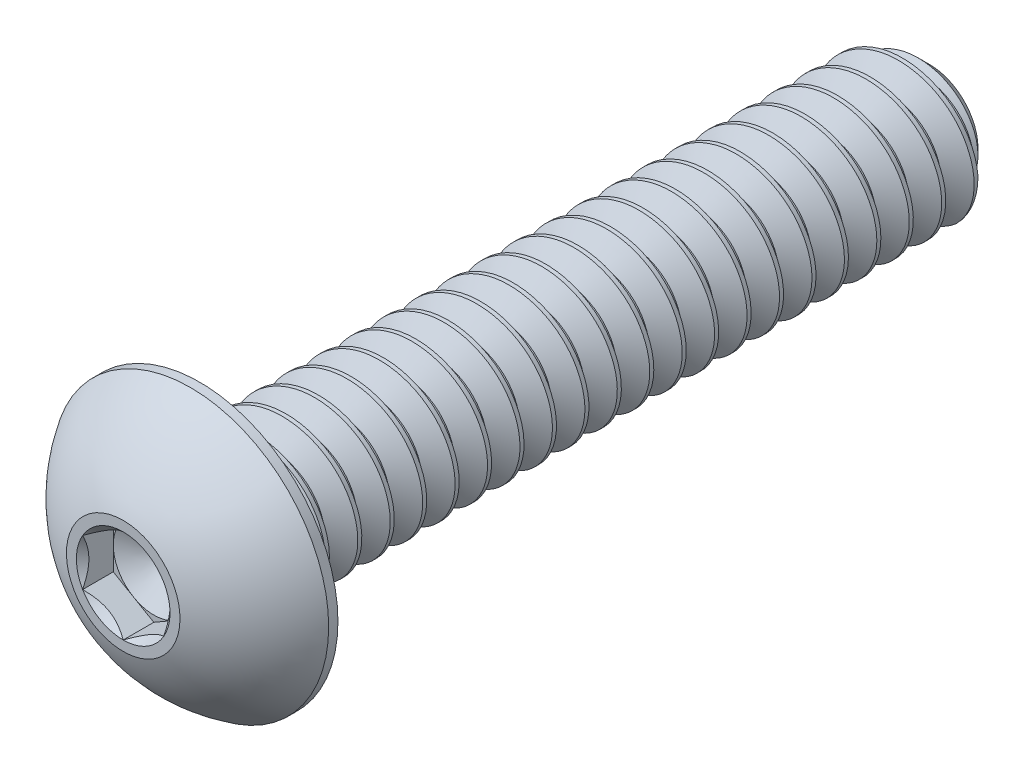
from build123d import *

# Parameters (mm, degrees)
CUT_EXTRUDE1_START = 7.29361
CUT_EXTRUDE1_DEPTH = 2.477670997
CUT_SWEEP1_PITCH   = 0.635
CUT_SWEEP1_TO      = 14.2875


with BuildPart() as part:
    # Sketch2 → Revolve1 (revolve)
    with BuildSketch(Plane(origin=(0, 0, 0), x_dir=(0, 0, -1), z_dir=(1, 0, 0)), mode=Mode.PRIVATE) as revolve1_sk:
        with BuildLine():
            Line((-7.89305, 0.79375), (-7.89305, 1.11125))
            ThreePointArc((-7.89305, 1.11125), (-7.36812089, 2.018629974), (-6.575878571, 2.7051))
            Line((-6.575878571, 2.7051), (-6.39445, 2.7051))
            Line((-6.39445, 2.7051), (-6.39445, 1.4224))
            Line((-6.39445, 1.4224), (7.4168, 1.4224))
            Line((7.4168, 1.4224), (7.89305, 0.94615))
            Line((7.89305, 0.94615), (7.89305, 0))
            Line((7.89305, 0), (-6.835338224, 0))
            Line((-6.835338224, 0), (-7.29361, 0.79375))
            Line((-7.29361, 0.79375), (-7.89305, 0.79375))
        make_face()
    revolve(revolve1_sk.sketch.rotate(Axis((0, 0, 7.89305), (0, 0, -1)), 90), axis=Axis((0, 0, 7.89305), (0, 0, -1)))

    # Sketch3 → Cut-Extrude1 (cut, through all)
    with BuildSketch(Plane.XY.offset(CUT_EXTRUDE1_START)):
        Polygon((0, 0.916543552), (-0.79375, 0.458271776), (-0.79375, -0.458271776), (0, -0.916543552), (0.79375, -0.458271776), (0.79375, 0.458271776), align=None)
    extrude(amount=CUT_EXTRUDE1_DEPTH, mode=Mode.SUBTRACT)

    # Cut-Extrude2 cone 1 section (through the dimple's axis) → Cut-Extrude2 (revolve, cut)
    with BuildSketch(Plane(origin=(0, 0, 7.89305), x_dir=(0, -1, 0), z_dir=(1, 0, 0))):
        Polygon((0, 0), (0.916543552, 0), (0, 0.916543552), align=None)
    revolve(axis=Axis((0, 0, 7.89305), (0, 0, -1)), mode=Mode.SUBTRACT)


with BuildPart() as body_2:
    # Split1: read off the stored shape, not the designer's step
    # Split1: the piece on the far side of the plane
    add(part.part)
    split(bisect_by=Plane.XY.offset(6.39445), keep=Keep.BOTTOM)

    # Cut-Sweep1: arcs per turn and ends read off the stored shape
    # Cut-Sweep1: the profile of Sketch6 profile screwed along a right-hand helix through 23.5 turns, 6 arcs to a turn; built about Z, then put on its axis
    cut_sweep1_z = Axis((0, 0, 0), (0, 0, 1))
    cut_sweep1_corners = [(1.4227, 0, 0.000173205), (1.4227, 0, -0.555798205), (1.009955401, 0, -0.3175), (1.009955401, 0, -0.238125)]
    with BuildLine(mode=Mode.PRIVATE) as cut_sweep1_profile:
        Line(cut_sweep1_corners[0], cut_sweep1_corners[1])
        Line(cut_sweep1_corners[1], cut_sweep1_corners[2])
        Line(cut_sweep1_corners[2], cut_sweep1_corners[3])
        Line(cut_sweep1_corners[3], cut_sweep1_corners[0])
    cut_sweep1_cap = Face(cut_sweep1_profile.wire())
    cut_sweep1_turn_angles = [0, 30, 60, 90, 120, 150, 180, 210, 240, 270, 300, 330, 360]
    cut_sweep1_turn_weights = [1, 0.8660254037844387, 1, 0.8660254037844387, 1, 0.8660254037844387, 1, 0.8660254037844387, 1, 0.8660254037844387, 1, 0.8660254037844387, 1]
    cut_sweep1_turn_rails = [Edge.make_bspline([Vector(p[0], p[1], 0).rotate(cut_sweep1_z, cut_sweep1_turn_angles[k]) / cut_sweep1_turn_weights[k] + Vector(0, 0, p[2] + CUT_SWEEP1_PITCH * cut_sweep1_turn_angles[k] / 360) for k in range(13)], [0, 0, 0, 1, 1, 2, 2, 3, 3, 4, 4, 5, 5, 6, 6, 6], 2, cut_sweep1_turn_weights) for p in cut_sweep1_corners]
    cut_sweep1_turn_sides = [Face.make_surface_from_curves(cut_sweep1_turn_rails[p[0]], cut_sweep1_turn_rails[p[1]]) for p in [(0, 1), (1, 2), (2, 3), (3, 0)]]
    cut_sweep1_last_angles = [8280, 8310, 8340, 8370, 8400, 8430, 8460]
    cut_sweep1_last_weights = [1, 0.8660254037844387, 1, 0.8660254037844387, 1, 0.8660254037841847, 1]
    cut_sweep1_last_rails = [Edge.make_bspline([Vector(p[0], p[1], 0).rotate(cut_sweep1_z, cut_sweep1_last_angles[k]) / cut_sweep1_last_weights[k] + Vector(0, 0, p[2] + CUT_SWEEP1_PITCH * cut_sweep1_last_angles[k] / 360) for k in range(7)], [0, 0, 0, 1, 1, 2, 2, 3, 3, 3], 2, cut_sweep1_last_weights) for p in cut_sweep1_corners]
    cut_sweep1_last_sides = [Face.make_surface_from_curves(cut_sweep1_last_rails[p[0]], cut_sweep1_last_rails[p[1]]) for p in [(0, 1), (1, 2), (2, 3), (3, 0)]]
    cut_sweep1 = Plane(origin=(0, 0, -7.89305), x_dir=(0, 1, 0), z_dir=(0, 0, 1)) * split(Solid(Shell([*[p.moved(Location((0, 0, CUT_SWEEP1_PITCH * i))) for i in range(23) for p in cut_sweep1_turn_sides], *cut_sweep1_last_sides, cut_sweep1_cap, cut_sweep1_cap.rotate(cut_sweep1_z, 8460).moved(Location((0, 0, CUT_SWEEP1_PITCH * 8460 / 360)))])), bisect_by=Plane.XY.offset(CUT_SWEEP1_TO), keep=Keep.BOTTOM, mode=Mode.PRIVATE)
    add(cut_sweep1, mode=Mode.SUBTRACT)


with BuildPart() as part_1:
    add(part.part)

    # Split1
    split(bisect_by=Plane.XY.offset(6.39445), keep=Keep.TOP)

    add(body_2.part)  # Boss-Extrude1 merges body 2
    # Boss-Extrude1 cone 1 section (through the dimple's axis) → Boss-Extrude1 (revolve)
    with BuildSketch(Plane(origin=(0, 0, 6.39445), x_dir=(0, -1, 0), z_dir=(1, 0, 0))):
        Polygon((0, 0), (1.429512, 0), (0, 2.475987414), align=None)
    revolve(axis=Axis((0, 0, 6.39445), (0, 0, -1)))


solid = part_1.part
